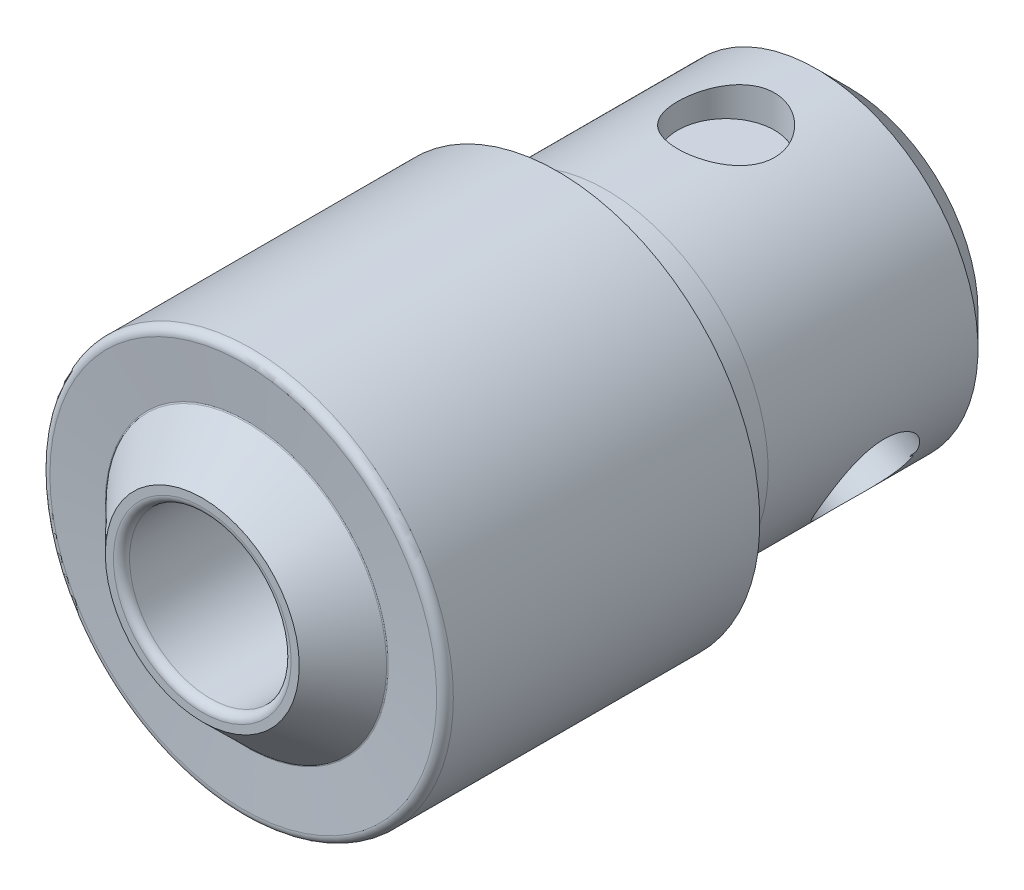
from build123d import *

# Parameters (mm, degrees)
SKETCH1_R           = 12.5
SKETCH1_R_2         = 5
BOSS_EXTRUDE1_DEPTH = 25
FILLET1_R           = 0.5
SKETCH3_R           = 10
BOSS_EXTRUDE2_DEPTH = 15
CHAMFER1_SIZE       = 2
SKETCH8_R           = 2.5
CUT_EXTRUDE1_DEPTH  = 24
CIRPATTERN1_COUNT   = 3
SKETCH6_R           = 5
CUT_EXTRUDE2_DEPTH  = 15
SKETCH5_R           = 3
CUT_EXTRUDE3_DEPTH  = 2
SKETCH9_R           = 12.50649661
SKETCH9_R_2         = 10.012344617
CUT_EXTRUDE4_DEPTH  = 3


with BuildPart() as part:
    # Sketch1 → Boss-Extrude1 (new body)
    with BuildSketch(Plane.XY):
        Circle(SKETCH1_R)
        Circle(SKETCH1_R_2, mode=Mode.SUBTRACT)
    extrude(amount=BOSS_EXTRUDE1_DEPTH)

    # Sketch2 → Cut-Revolve1 (revolve, cut)
    with BuildSketch(Plane(origin=(0, 0, 0), x_dir=(0, 0, -1), z_dir=(1, 0, 0)), mode=Mode.PRIVATE) as cut_revolve1_sk:
        with BuildLine():
            Line((-25, 12.5), (-22.5, 12.5))
            Line((-22.5, 12.5), (-22.243655425, 8.754806092))
            ThreePointArc((-22.243655425, 8.754806092), (-22.249944012, 8.712454692), (-22.273368866, 8.676615278))
            Line((-22.273368866, 8.676615278), (-25, 6))
            Line((-25, 6), (-25, 12.5))
        make_face()
    revolve(cut_revolve1_sk.sketch.rotate(Axis((0, 0, 0.001410909), (0, 0, 1)), 90), axis=Axis((0, 0, 0.001410909), (0, 0, 1)), mode=Mode.SUBTRACT)

    # Fillet1
    fillet1_edges = [part.edges().sort_by_distance(p)[0] for p in [
        (0, -12.5, 22.5),
        (-5, 0, 25),
    ]]
    fillet(fillet1_edges, radius=FILLET1_R)

    # Sketch9 → Cut-Extrude4 (cut)
    with BuildSketch(Plane(origin=(0, 0, 0), x_dir=(-1, 0, 0), z_dir=(0, 0, -1))):
        Circle(SKETCH9_R)
        Circle(SKETCH9_R_2, mode=Mode.SUBTRACT)
    extrude(amount=-CUT_EXTRUDE4_DEPTH, mode=Mode.SUBTRACT)


with BuildPart() as body_2:
    # Sketch3 → Boss-Extrude2 (new body)
    with BuildSketch(Plane(origin=(0, 0, 0), x_dir=(-1, 0, 0), z_dir=(0, 0, -1))):
        Circle(SKETCH3_R)
    extrude(amount=BOSS_EXTRUDE2_DEPTH)

    # Chamfer1
    chamfer1_edges = [body_2.edges().sort_by_distance(p)[0] for p in [
        (10, 0, -15),
    ]]
    chamfer(chamfer1_edges, length=CHAMFER1_SIZE)

    # Sketch8 → Cut-Extrude1 (cut)
    with BuildSketch(Plane(origin=(0, 0.037926228, -25), x_dir=(1, 0, 0), z_dir=(0, -0.138325230756588, 0.9903868590283985))):
        with Locations(Location((-0.058992617, -2.778294742, 0), (0, 0, 90))):
            Circle(SKETCH8_R)
    cut_extrude1 = extrude(amount=CUT_EXTRUDE1_DEPTH, mode=Mode.SUBTRACT)

    # CirPattern1: Cut-Extrude1 ×3 about axis
    cirpattern1_axis = Axis((0, -0.013059311, -5), (0, 0.0025492686554308094, -0.999996750609382))
    for i in range(1, CIRPATTERN1_COUNT):
        add(cut_extrude1.rotate(cirpattern1_axis, i * 360 / CIRPATTERN1_COUNT), mode=Mode.SUBTRACT)

    # Sketch6 → Cut-Extrude2 (cut)
    with BuildSketch(Plane(origin=(0, 0, -15), x_dir=(-1, 0, 0), z_dir=(0, 0, -1))):
        with Locations((0.012275783, 0.001033832)):
            Circle(SKETCH6_R)
    extrude(amount=-CUT_EXTRUDE2_DEPTH, mode=Mode.SUBTRACT)

    # Sketch5 → Cut-Extrude3 (cut)
    with BuildSketch(Plane(origin=(0, 10, 0), x_dir=(1, 0, 0), z_dir=(0, 1, 0))):
        with Locations(Location((0, 7.414094895, 0), (0, 0, 270))):
            Circle(SKETCH5_R)
    extrude(amount=-CUT_EXTRUDE3_DEPTH, mode=Mode.SUBTRACT)

    # CirPattern2: read off the stored shape, not the designer's step
    # CirPattern2: loft between two sections, ruled curve by curve
    cirpattern2_from = [
        Edge.make_three_point_arc((-6.850635196, -4.132036407, -10.441076683), (-5.436473367, -6.605518147, -7.297506356), (-7.01768621, -3.888522832, -4.448348164)),
        Edge.make_three_point_arc((-7.01768621, -3.888522832, -4.448348164), (-8.431848039, -1.415041091, -7.591918491), (-6.850635196, -4.132036407, -10.441076683)),
    ]
    cirpattern2_to = [
        Edge.make_three_point_arc((-8.582680376, -5.13201691, -10.448724464), (-7.168518547, -7.605498651, -7.305154137), (-8.749731389, -4.888503336, -4.455995946)),
        Edge.make_three_point_arc((-8.749731389, -4.888503336, -4.455995946), (-10.163893219, -2.415021595, -7.599566272), (-8.582680376, -5.13201691, -10.448724464)),
    ]
    cirpattern2 = Solid(Shell([*[Face.make_surface_from_curves(cirpattern2_from[k], cirpattern2_to[k]) for k in range(2)], Face(Wire(cirpattern2_from)), Face(Wire(cirpattern2_to))]))
    add(cirpattern2, mode=Mode.SUBTRACT)

    # CirPattern2 2: loft between two sections, ruled curve by curve
    cirpattern2_2_from = [
        Edge.make_three_point_arc((7.003747149, -3.866839031, -10.440473183), (8.43256038, -1.41614922, -7.285697089), (6.864574257, -4.153720208, -4.448951665)),
        Edge.make_three_point_arc((6.864574257, -4.153720208, -4.448951665), (5.435761026, -6.604410019, -7.603727758), (7.003747149, -3.866839031, -10.440473183)),
    ]
    cirpattern2_2_to = [
        Edge.make_three_point_arc((8.735792329, -4.866819535, -10.448120964), (10.16460556, -2.416129723, -7.29334487), (8.596619436, -5.153700711, -4.456599446)),
        Edge.make_three_point_arc((8.596619436, -5.153700711, -4.456599446), (7.167806205, -7.604390523, -7.611375539), (8.735792329, -4.866819535, -10.448120964)),
    ]
    cirpattern2_2 = Solid(Shell([*[Face.make_surface_from_curves(cirpattern2_2_from[k], cirpattern2_2_to[k]) for k in range(2)], Face(Wire(cirpattern2_2_from)), Face(Wire(cirpattern2_2_to))]))
    add(cirpattern2_2, mode=Mode.SUBTRACT)


solid = Compound([part.part, body_2.part])
